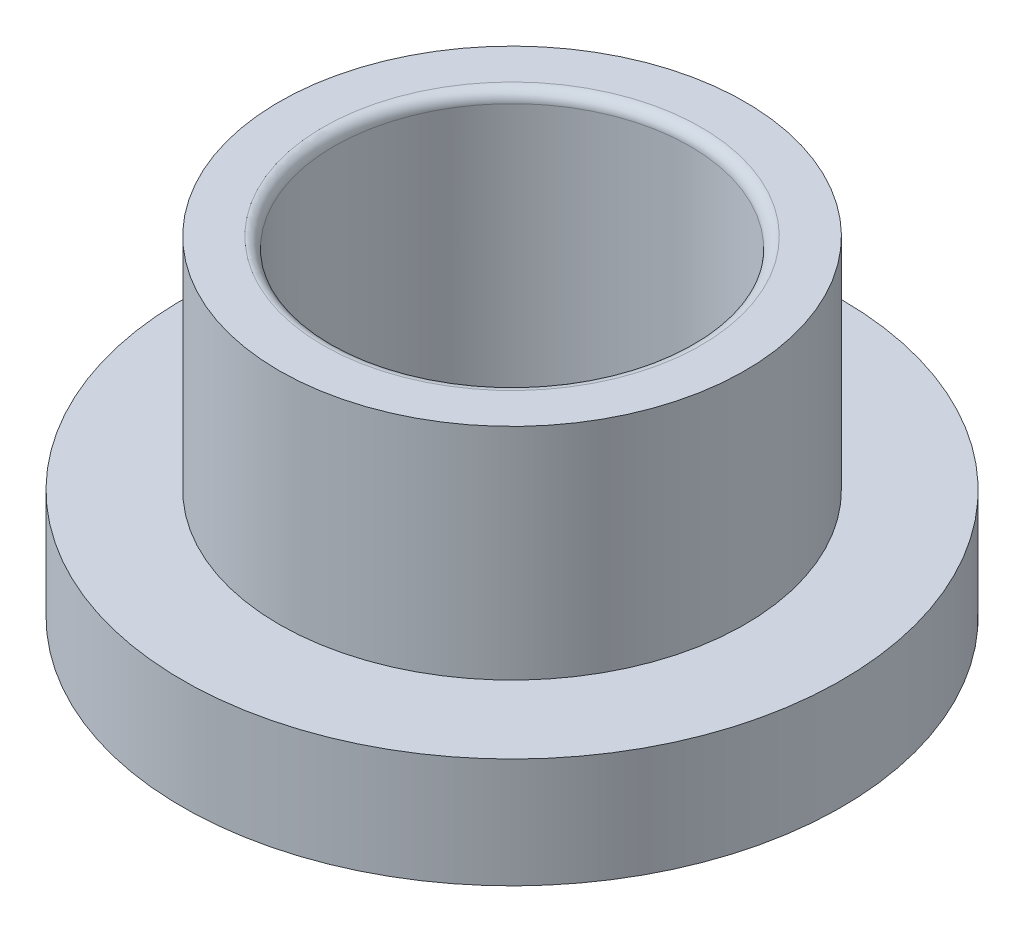
from build123d import *

# Parameters (mm, degrees)
SKETCH1_R           = 21.2
SKETCH1_R_2         = 16.2
BOSS_EXTRUDE1_DEPTH = 20
FILLET1_R           = 1
BOSS_EXTRUDE2_START = 10
SKETCH2_R           = 30
SKETCH2_R_2         = 16.2
BOSS_EXTRUDE2_DEPTH = 10


with BuildPart() as part:
    # Sketch1 → Boss-Extrude1 (new body)
    with BuildSketch(Plane(origin=(0, 0, 0), x_dir=(1, 0, 0), z_dir=(0, 1, 0))):
        Circle(SKETCH1_R)
        Circle(SKETCH1_R_2, mode=Mode.SUBTRACT)
    extrude(amount=BOSS_EXTRUDE1_DEPTH)

    # Fillet1
    fillet1_edges = [part.edges().sort_by_distance(p)[0] for p in [
        (-16.2, 20, 0),
    ]]
    fillet(fillet1_edges, radius=FILLET1_R)

    # Sketch2 → Boss-Extrude2 (add)
    with BuildSketch(Plane.XZ.offset(BOSS_EXTRUDE2_START)):
        Circle(SKETCH2_R)
        Circle(SKETCH2_R_2, mode=Mode.SUBTRACT)
    extrude(amount=-BOSS_EXTRUDE2_DEPTH)


solid = part.part
